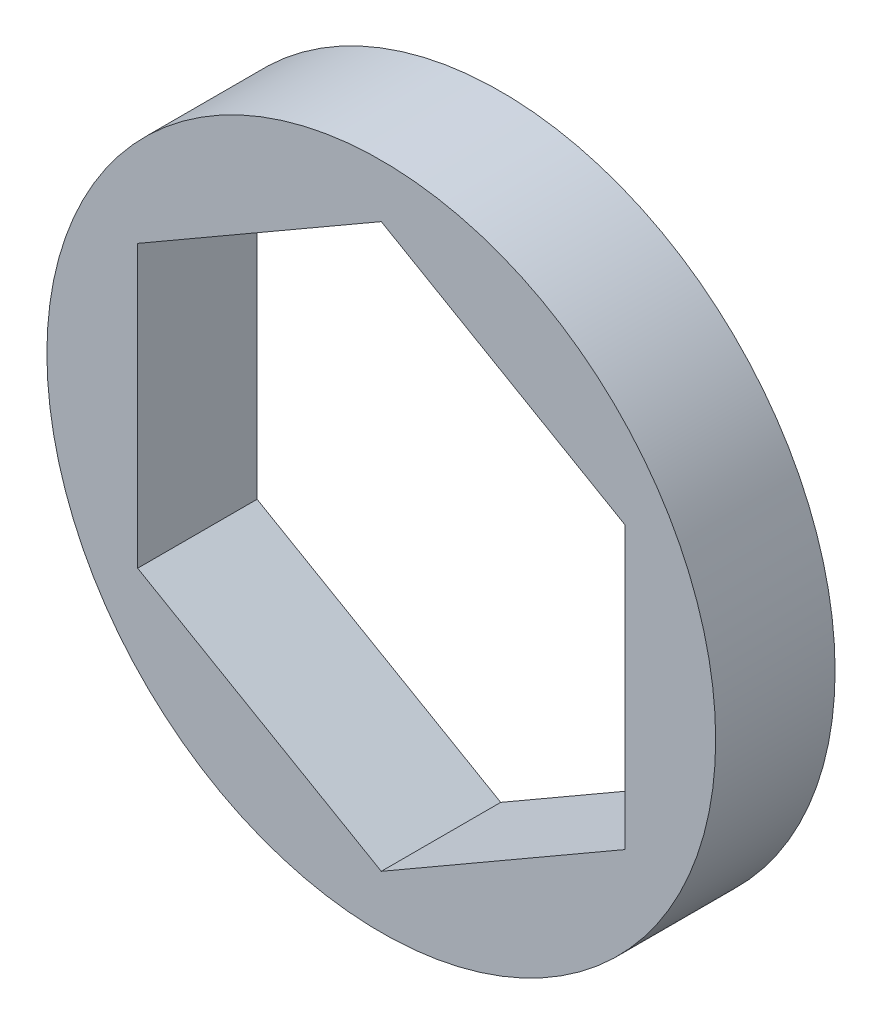
from build123d import *

# Parameters (mm, degrees)
SKETCH1_R           = 8.89
BOSS_EXTRUDE1_DEPTH = 3.175


with BuildPart() as part:
    # Sketch1 → Boss-Extrude1 (new body)
    with BuildSketch(Plane.XY):
        Circle(SKETCH1_R)
        Polygon((0, 7.478995387), (-6.477, 3.739497694), (-6.477, -3.739497694), (0, -7.478995387), (6.477, -3.739497694), (6.477, 3.739497694), align=None, mode=Mode.SUBTRACT)
    extrude(amount=BOSS_EXTRUDE1_DEPTH)


solid = part.part
